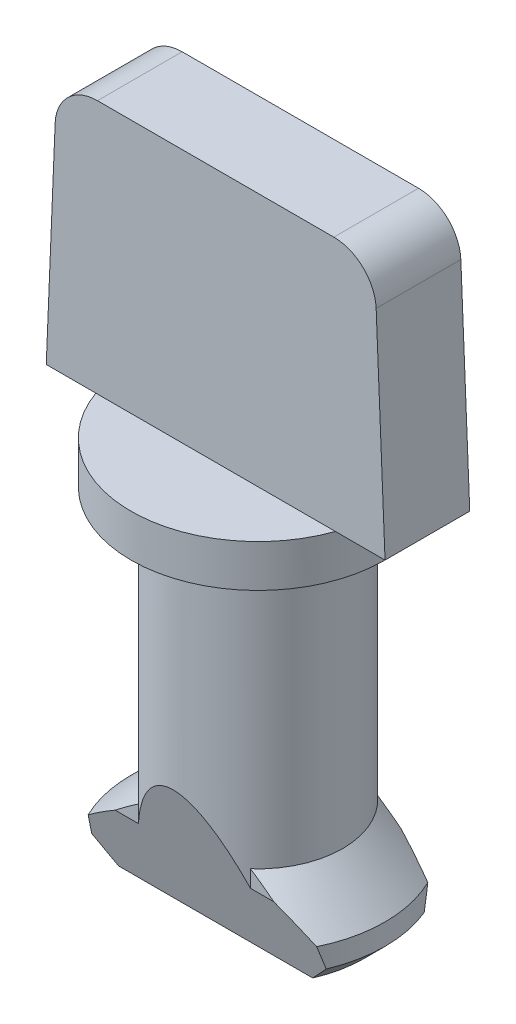
from build123d import *

# Parameters (mm, degrees)
SKETCH_1_R                      = 3
EXTRUDE_1_DEPTH                 = 1
EXTRUDE_2_DEPTH                 = 1
EXTRUDE_2_DEPTH_BACK            = 1
FILLET_1_R                      = 1
SKETCH_3_R                      = 2
EXTRUDE_3_DEPTH                 = 8.4
EXTRUDE_4_DEPTH                 = 2
CHAMFER_1_SIZE                  = 0.5
CHAMFER_2_SIZE                  = 1
CUT_EXTRUDE_1_REACH             = 11.775
CUT_EXTRUDE_1_DIRECTION_2_REACH = 11.775


with BuildPart() as part:
    # 草图1 → 凸台-拉伸1 (new body)
    with BuildSketch(Plane(origin=(0, 0, 0), x_dir=(1, 0, 0), z_dir=(0, 1, 0))):
        with Locations(Location((0, 0, 0), (0, 0, 270))):
            Circle(SKETCH_1_R)
    extrude(amount=EXTRUDE_1_DEPTH)

    # 草图2 → 凸台-拉伸2 (add, two sides: drawn at the far end of the back side and taken through both)
    with BuildSketch(Plane.XY.offset(-EXTRUDE_2_DEPTH_BACK)):
        Polygon((-3.75, 7), (3.75, 7), (4, 1), (-4, 1), align=None)
    extrude(amount=EXTRUDE_2_DEPTH + EXTRUDE_2_DEPTH_BACK)

    # 圆角1
    fillet_1_edges = [part.edges().sort_by_distance(p)[0] for p in [
        (-3.75, 7, 0),
        (3.75, 7, 0),
    ]]
    fillet(fillet_1_edges, radius=FILLET_1_R)

    # 草图3 → 凸台-拉伸3 (add)
    with BuildSketch(Plane(origin=(0, 0, 0), x_dir=(-1, 0, 0), z_dir=(0, -1, 0))):
        with Locations(Location((0, 0, 0), (0, 0, 270))):
            Circle(SKETCH_3_R)
    extrude(amount=EXTRUDE_3_DEPTH)

    # 草图4 → 凸台-拉伸4 (add)
    with BuildSketch(Plane(origin=(0, -8.4, 0), x_dir=(-1, 0, 0), z_dir=(0, -1, 0))):
        with BuildLine():
            Line((2.598076211, -1.5), (-2.598076211, -1.5))
            ThreePointArc((-2.598076211, -1.5), (-3, 0), (-2.598076211, 1.5))
            Line((-2.598076211, 1.5), (2.598076211, 1.5))
            ThreePointArc((2.598076211, 1.5), (3, 0), (2.598076211, -1.5))
        make_face()
    extrude(amount=-EXTRUDE_4_DEPTH)

    # 倒角1
    chamfer_1_edges = [part.edges().sort_by_distance(p)[0] for p in [
        (3, -8.4, 0),
        (-3, -8.4, 0),
    ]]
    chamfer(chamfer_1_edges, length=CHAMFER_1_SIZE)

    # 倒角2
    chamfer_2_edges = [part.edges().sort_by_distance(p)[0] for p in [
        (3, -6.4, 0),
        (-3, -6.4, 0),
    ]]
    chamfer(chamfer_2_edges, length=CHAMFER_2_SIZE - 0.0001)  # a hair under: the kernel refuses the full size

    # 草图5 → 切除-拉伸1 (cut, up to next)
    with BuildSketch(Plane(origin=(0, 0, 0), x_dir=(0, 0, -1), z_dir=(1, 0, 0)), mode=Mode.PRIVATE) as cut_extrude_1_sk1:
        Polygon((2, -5.2), (1, -8.4), (2, -8.4), align=None)
    cut_extrude_1_tool1 = extrude(cut_extrude_1_sk1.sketch, amount=-CUT_EXTRUDE_1_REACH, mode=Mode.PRIVATE) & part.part
    # 草图5 → 切除-拉伸1 (cut, up to next)
    with BuildSketch(Plane(origin=(0, 0, 0), x_dir=(0, 0, -1), z_dir=(1, 0, 0)), mode=Mode.PRIVATE) as cut_extrude_1_sk2:
        Polygon((-2, -5.2), (-2, -8.4), (-1, -8.4), align=None)
    cut_extrude_1_tool2 = extrude(cut_extrude_1_sk2.sketch, amount=-CUT_EXTRUDE_1_REACH, mode=Mode.PRIVATE) & part.part
    add(cut_extrude_1_tool1.solids().sort_by_distance((0, -7.333333, -1.666667))[0], mode=Mode.SUBTRACT)
    add(cut_extrude_1_tool2.solids().sort_by_distance((0, -7.333333, 1.666667))[0], mode=Mode.SUBTRACT)

    # 草图5 → 切除-拉伸1 direction 2 (cut, up to next)
    with BuildSketch(Plane(origin=(0, 0, 0), x_dir=(0, 0, -1), z_dir=(1, 0, 0)), mode=Mode.PRIVATE) as cut_extrude_1_direction_2_sk1:
        Polygon((2, -5.2), (1, -8.4), (2, -8.4), align=None)
    cut_extrude_1_direction_2_tool1 = extrude(cut_extrude_1_direction_2_sk1.sketch, amount=CUT_EXTRUDE_1_DIRECTION_2_REACH, mode=Mode.PRIVATE) & part.part
    # 草图5 → 切除-拉伸1 direction 2 (cut, up to next)
    with BuildSketch(Plane(origin=(0, 0, 0), x_dir=(0, 0, -1), z_dir=(1, 0, 0)), mode=Mode.PRIVATE) as cut_extrude_1_direction_2_sk2:
        Polygon((-2, -5.2), (-2, -8.4), (-1, -8.4), align=None)
    cut_extrude_1_direction_2_tool2 = extrude(cut_extrude_1_direction_2_sk2.sketch, amount=CUT_EXTRUDE_1_DIRECTION_2_REACH, mode=Mode.PRIVATE) & part.part
    add(cut_extrude_1_direction_2_tool1.solids().sort_by_distance((0, -7.333333, -1.666667))[0], mode=Mode.SUBTRACT)
    add(cut_extrude_1_direction_2_tool2.solids().sort_by_distance((0, -7.333333, 1.666667))[0], mode=Mode.SUBTRACT)


solid = part.part
